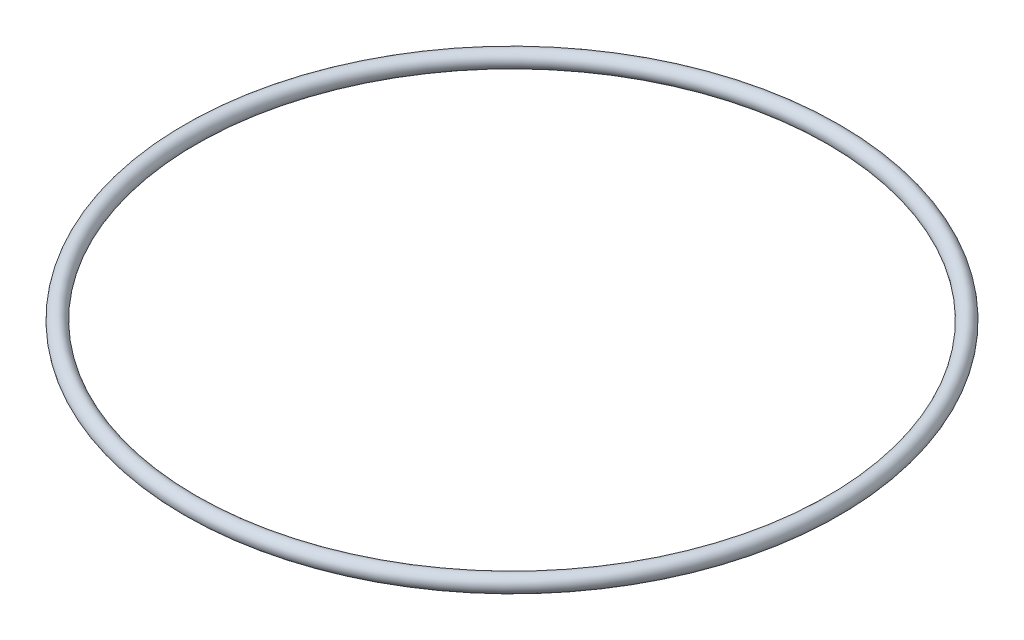
from build123d import *

# Parameters (mm, degrees)
ESQUISSE1_R = 0.5


with BuildPart() as part:
    # Esquisse1 → Révolution1 (revolve)
    with BuildSketch(Plane.XY):
        with Locations((-20, 0)):
            Circle(ESQUISSE1_R)
    revolve(axis=Axis((0, 0, 0), (0, 1, 0)))


solid = part.part
